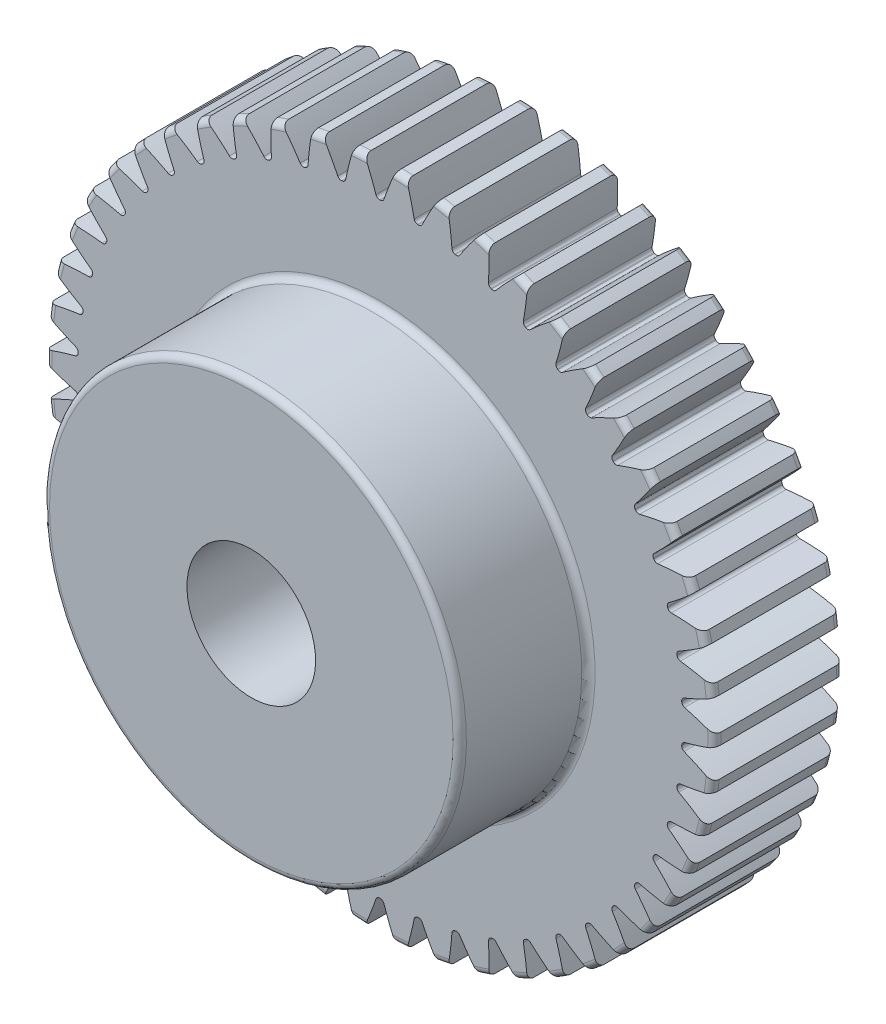
from build123d import *

# Parameters (mm, degrees)
FILLET2_R          = 0.6604
CUT_EXTRUDE2_DEPTH = 49.3934997
CIRPATTERN1_COUNT  = 50


with BuildPart() as part:
    # Sketch4 → Revolve1 (revolve)
    with BuildSketch(Plane(origin=(0, 0, 0), x_dir=(0, 0, -1), z_dir=(1, 0, 0))):
        Polygon((-25.4, 6.35), (-25.4, 20.574), (-12.7, 20.574), (-12.7, 33.02), (0, 33.02), (0, 6.35), align=None)
    revolve(axis=Axis((0, 0, 12.7), (0, 0, 1)))

    # Fillet2
    fillet2_edges = [part.edges().sort_by_distance(p)[0] for p in [
        (0, -20.574, 25.4),
        (0, -20.574, 12.7),
        (0, -33.02, 12.7),
        (0, -33.02, 0),
    ]]
    fillet(fillet2_edges, radius=FILLET2_R)

    # Sketch7 → Cut-Extrude2 (cut, through all)
    with BuildSketch(Plane.XY.offset(12.7)):
        with BuildLine():
            ThreePointArc((-0.034997166, 29.844979481), (0, 29.845), (0.034997166, 29.844979481))
            ThreePointArc((0.034997166, 29.844979481), (0.257434461, 29.916325895), (0.396433644, 30.104070106))
            ThreePointArc((0.396433644, 30.104070106), (0.927426961, 31.5581379), (1.528661943, 32.984596294))
            ThreePointArc((1.528661943, 32.984596294), (0, 33.02), (-1.528661943, 32.984596294))
            ThreePointArc((-1.528661943, 32.984596294), (-0.927426961, 31.5581379), (-0.396433644, 30.104070106))
            ThreePointArc((-0.396433644, 30.104070106), (-0.257434461, 29.916325895), (-0.034997166, 29.844979481))
        make_face()
    cut_extrude2 = extrude(amount=-CUT_EXTRUDE2_DEPTH, mode=Mode.SUBTRACT)

    # CirPattern1: Cut-Extrude2 ×50 about axis
    cirpattern1_axis = Axis((0, 0, 25.4), (0, 0, -1))
    for i in range(1, CIRPATTERN1_COUNT):
        add(cut_extrude2.rotate(cirpattern1_axis, i * 360 / CIRPATTERN1_COUNT), mode=Mode.SUBTRACT)


solid = part.part
